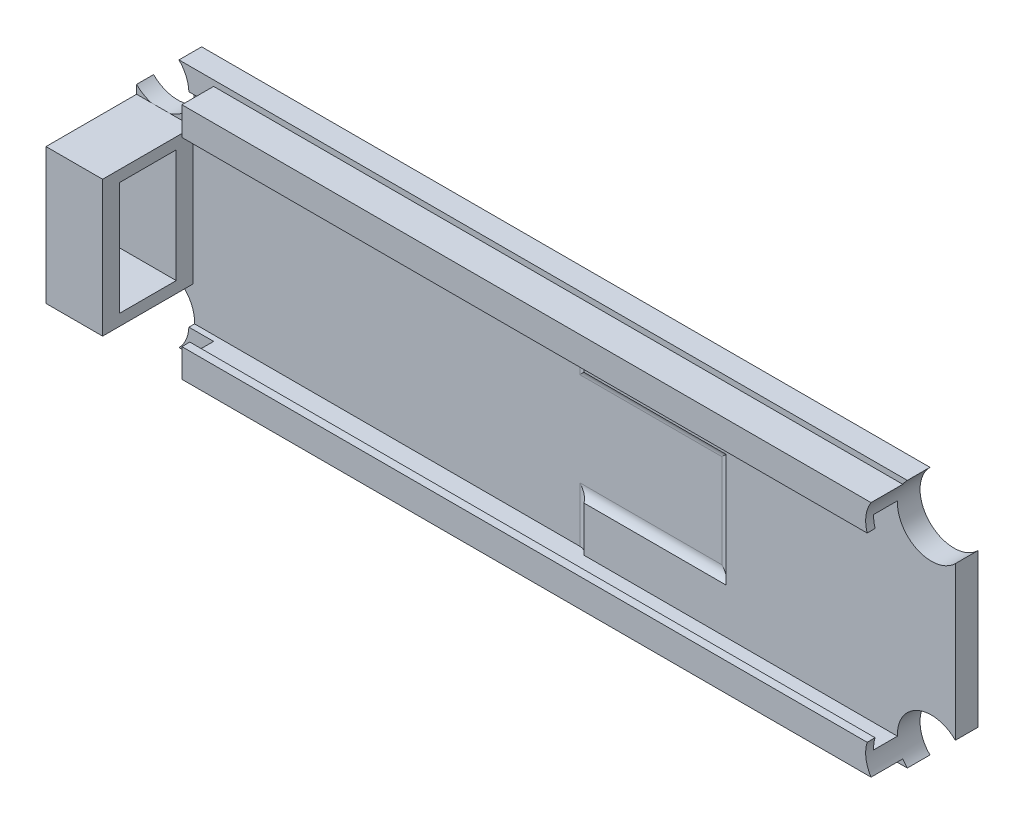
from build123d import *

# Parameters (mm, degrees)
SKIZZE1_W                       = 22
SKIZZE1_H                       = 72.8
AUFSATZ_LINEAR_AUSTRAGEN1_DEPTH = 2
SKIZZE2_R                       = 3
SCHNITT_LINEAR_AUSTRAGEN1_DEPTH = 2
SKIZZE3_W                       = 65.5
SKIZZE3_H                       = 21
AUFSATZ_LINEAR_AUSTRAGEN2_DEPTH = 2.8
SCHNITT_LINEAR_AUSTRAGEN2_DEPTH = 67.590464783
SKIZZE5_R                       = 3
SCHNITT_LINEAR_AUSTRAGEN4_DEPTH = 39.128729326
SKIZZE6_W                       = 18
SKIZZE6_H                       = 1
SCHNITT_LINEAR_AUSTRAGEN5_DEPTH = 40
SKIZZE8_W                       = 15
SKIZZE8_H                       = 10
SCHNITT_LINEAR_AUSTRAGEN6_DEPTH = 0.5
VERRUNDUNG3_R                   = 1
SKIZZE9_W                       = 5
SKIZZE9_H                       = 12
AUFSATZ_LINEAR_AUSTRAGEN3_DEPTH = 8
SKIZZE10_W                      = 10
SKIZZE10_H                      = 5
SCHNITT_LINEAR_AUSTRAGEN7_DEPTH = 75.236715983


with BuildPart() as part:
    # Skizze1 → Aufsatz-Linear austragen1 (new body)
    with BuildSketch(Plane(origin=(0, 0, 0), x_dir=(0, 1, 0), z_dir=(0, 0, 1))):
        Rectangle(SKIZZE1_W, SKIZZE1_H)
    extrude(amount=AUFSATZ_LINEAR_AUSTRAGEN1_DEPTH)

    # Skizze2 → Schnitt-Linear austragen1 (cut)
    with BuildSketch(Plane.XY.offset(2)):
        with Locations((-34.28, 8.88)):
            Circle(SKIZZE2_R)
        with Locations((-34.28, -8.88)):
            Circle(SKIZZE2_R)
        with Locations((34.28, -8.88)):
            Circle(SKIZZE2_R)
        with Locations((34.28, 8.88)):
            Circle(SKIZZE2_R)
    extrude(amount=-SCHNITT_LINEAR_AUSTRAGEN1_DEPTH, mode=Mode.SUBTRACT)

    # Skizze3 → Aufsatz-Linear austragen2 (add)
    with BuildSketch(Plane.XY.offset(2)):
        with Locations((3.65, 0)):
            Rectangle(SKIZZE3_W, SKIZZE3_H)
    extrude(amount=AUFSATZ_LINEAR_AUSTRAGEN2_DEPTH)

    # Skizze4 → Schnitt-Linear austragen2 (cut, through all)
    with BuildSketch(Plane(origin=(-29.1, 0, 0), x_dir=(0, -1, 0), z_dir=(-1, 0, 0))):
        Polygon((-8, 4.8), (8, 4.8), (8, 4.1), (9, 4.1), (9, 2), (-9, 2), (-9, 4.1), (-8, 4.1), align=None)
    extrude(amount=-SCHNITT_LINEAR_AUSTRAGEN2_DEPTH, mode=Mode.SUBTRACT)

    # Skizze5 → Schnitt-Linear austragen4 (cut, through all)
    with BuildSketch(Plane(origin=(0, 0, 2), x_dir=(1, 0, 0), z_dir=(0, 0, -1))):
        with Locations((34.28, -8.88)):
            Circle(SKIZZE5_R)
        with Locations((34.28, 8.88)):
            Circle(SKIZZE5_R)
    extrude(amount=-SCHNITT_LINEAR_AUSTRAGEN4_DEPTH, mode=Mode.SUBTRACT)

    # Skizze6 → Schnitt-Linear austragen5 (cut)
    with BuildSketch(Plane(origin=(-36.4, 0, 0), x_dir=(0, -1, 0), z_dir=(-1, 0, 0))):
        with Locations((0, 2)):
            Rectangle(SKIZZE6_W, SKIZZE6_H)
    extrude(amount=-SCHNITT_LINEAR_AUSTRAGEN5_DEPTH, mode=Mode.SUBTRACT)

    # Skizze8 → Schnitt-Linear austragen6 (cut)
    with BuildSketch(Plane.XY.offset(2)):
        with Locations((8.655984658, -0.007335612)):
            Rectangle(SKIZZE8_W, SKIZZE8_H)
    extrude(amount=-SCHNITT_LINEAR_AUSTRAGEN6_DEPTH, mode=Mode.SUBTRACT)

    # Verrundung3
    # the kernel refuses this fillet: 1 mm, written as the material it adds along each edge
    with BuildSketch(Plane(origin=(3.6, -9, 1.5), x_dir=(0, 0, 1), z_dir=(0, 1, 0))) as verrundung3_piece_1:
        with BuildLine():
            CenterArc((1, -0.866025404), VERRUNDUNG3_R, 120, 60)
            Line((0, -0.866025404), (-0.02, -0.866025404))
            Line((-0.02, -0.866025404), (-0.02, 0))
            Line((-0.02, 0), (0, 0.02))
            ThreePointArc((0, 0.02), (0.25, 0.02), (0.49, 0.017320508))
            Line((0.49, 0.017320508), (0.5, 0))
        make_face()
    extrude(amount=3.992664388)
    with BuildSketch(Plane(origin=(3.6, -5.007335612, 1.5), x_dir=(0, 0, 1), z_dir=(1, 0, 0)), Plane(origin=(16.155984658, 4.992664388, 1.5), x_dir=(0, 0, 1), z_dir=(-1, 0, 0))) as verrundung3_piece_2:
        with BuildLine():
            CenterArc((1, -0.866025404), VERRUNDUNG3_R, 120, 60)
            Line((0, -0.866025404), (-0.02, -0.866025404))
            Line((-0.02, -0.866025404), (-0.02, 0))
            Line((-0.02, 0), (0, 0.02))
            ThreePointArc((0, 0.02), (0.25, 0.02), (0.49, 0.017320508))
            Line((0.49, 0.017320508), (0.5, 0))
        make_face()
    extrude(amount=12.555984658)
    with BuildSketch(Plane(origin=(3.6, 4.992664388, 1.5), x_dir=(0, 0, 1), z_dir=(0, 1, 0))) as verrundung3_piece_3:
        with BuildLine():
            CenterArc((1, -0.866025404), VERRUNDUNG3_R, 120, 60)
            Line((0, -0.866025404), (-0.02, -0.866025404))
            Line((-0.02, -0.866025404), (-0.02, 0))
            Line((-0.02, 0), (0, 0.02))
            ThreePointArc((0, 0.02), (0.25, 0.02), (0.49, 0.017320508))
            Line((0.49, 0.017320508), (0.5, 0))
        make_face()
    extrude(amount=4.007335612)
    with BuildSketch(Plane(origin=(16.155984658, -5.007335612, 1.5), x_dir=(0, 0, 1), z_dir=(0, 1, 0))) as verrundung3_piece_4:
        with BuildLine():
            CenterArc((1, -0.866025404), VERRUNDUNG3_R, 120, 60)
            Line((0, -0.866025404), (-0.02, -0.866025404))
            Line((-0.02, -0.866025404), (-0.02, 0))
            Line((-0.02, 0), (0, 0.02))
            ThreePointArc((0, 0.02), (0.25, 0.02), (0.49, 0.017320508))
            Line((0.49, 0.017320508), (0.5, 0))
        make_face()
    extrude(amount=10)
    with BuildSketch(Plane(origin=(3.6, -9, 1.5), x_dir=(0, 0, 1), z_dir=(0, 1, 0))) as verrundung3_piece_5a_section:
        with BuildLine():
            CenterArc((1, -0.866025404), VERRUNDUNG3_R, 120, 60)
            Line((0, -0.866025404), (-0.02, -0.866025404))
            Line((-0.02, -0.866025404), (-0.02, 0))
            Line((-0.02, 0), (0, 0.02))
            ThreePointArc((0, 0.02), (0.25, 0.02), (0.49, 0.017320508))
            Line((0.49, 0.017320508), (0.5, 0))
        make_face()
    verrundung3_piece_5a = extrude(amount=6.157727897, mode=Mode.PRIVATE)
    verrundung3_piece_5a = split(verrundung3_piece_5a, bisect_by=Plane(origin=(3.383689554, -5.007335612, 1.629516711), z_dir=(0, 1, 0)), keep=Keep.TOP, mode=Mode.PRIVATE)
    with BuildSketch(Plane(origin=(1.434936491, -5.007335612, 1.5), x_dir=(0, 0, 1), z_dir=(1, 0, 0))) as verrundung3_piece_5b_section:
        with BuildLine():
            CenterArc((1, -0.866025404), VERRUNDUNG3_R, 120, 60)
            Line((0, -0.866025404), (-0.02, -0.866025404))
            Line((-0.02, -0.866025404), (-0.02, 0))
            Line((-0.02, 0), (0, 0.02))
            ThreePointArc((0, 0.02), (0.25, 0.02), (0.49, 0.017320508))
            Line((0.49, 0.017320508), (0.5, 0))
        make_face()
    verrundung3_piece_5b = extrude(amount=14.721048168, mode=Mode.PRIVATE)
    verrundung3_piece_5b = split(verrundung3_piece_5b, bisect_by=Plane(origin=(3.6, -4.791025166, 1.629516711), z_dir=(-1, 0, 0)), keep=Keep.TOP, mode=Mode.PRIVATE)
    verrundung3_piece_5 = verrundung3_piece_5a & verrundung3_piece_5b
    add(verrundung3_piece_5)
    with BuildSketch(Plane(origin=(3.6, -5.007335612, 1.5), x_dir=(0, 0, 1), z_dir=(1, 0, 0))) as verrundung3_piece_6a_section:
        with BuildLine():
            CenterArc((1, -0.866025404), VERRUNDUNG3_R, 120, 60)
            Line((0, -0.866025404), (-0.02, -0.866025404))
            Line((-0.02, -0.866025404), (-0.02, 0))
            Line((-0.02, 0), (0, 0.02))
            ThreePointArc((0, 0.02), (0.25, 0.02), (0.49, 0.017320508))
            Line((0.49, 0.017320508), (0.5, 0))
        make_face()
    verrundung3_piece_6a = extrude(amount=14.721048168, mode=Mode.PRIVATE)
    verrundung3_piece_6a = split(verrundung3_piece_6a, bisect_by=Plane(origin=(16.155984658, -4.791025166, 1.629516711), z_dir=(1, 0, 0)), keep=Keep.TOP, mode=Mode.PRIVATE)
    with BuildSketch(Plane(origin=(16.155984658, -7.172399122, 1.5), x_dir=(0, 0, 1), z_dir=(0, 1, 0))) as verrundung3_piece_6b_section:
        with BuildLine():
            CenterArc((1, -0.866025404), VERRUNDUNG3_R, 120, 60)
            Line((0, -0.866025404), (-0.02, -0.866025404))
            Line((-0.02, -0.866025404), (-0.02, 0))
            Line((-0.02, 0), (0, 0.02))
            ThreePointArc((0, 0.02), (0.25, 0.02), (0.49, 0.017320508))
            Line((0.49, 0.017320508), (0.5, 0))
        make_face()
    verrundung3_piece_6b = extrude(amount=12.165063509, mode=Mode.PRIVATE)
    verrundung3_piece_6b = split(verrundung3_piece_6b, bisect_by=Plane(origin=(15.939674213, -5.007335612, 1.629516711), z_dir=(0, -1, 0)), keep=Keep.TOP, mode=Mode.PRIVATE)
    verrundung3_piece_6 = verrundung3_piece_6a & verrundung3_piece_6b
    add(verrundung3_piece_6)
    with BuildSketch(Plane(origin=(16.155984658, 4.992664388, 1.5), x_dir=(0, 0, 1), z_dir=(-1, 0, 0))) as verrundung3_piece_7a_section:
        with BuildLine():
            CenterArc((1, -0.866025404), VERRUNDUNG3_R, 120, 60)
            Line((0, -0.866025404), (-0.02, -0.866025404))
            Line((-0.02, -0.866025404), (-0.02, 0))
            Line((-0.02, 0), (0, 0.02))
            ThreePointArc((0, 0.02), (0.25, 0.02), (0.49, 0.017320508))
            Line((0.49, 0.017320508), (0.5, 0))
        make_face()
    verrundung3_piece_7a = extrude(amount=14.721048168, mode=Mode.PRIVATE)
    verrundung3_piece_7a = split(verrundung3_piece_7a, bisect_by=Plane(origin=(3.6, 4.776353942, 1.629516711), z_dir=(-1, 0, 0)), keep=Keep.TOP, mode=Mode.PRIVATE)
    with BuildSketch(Plane(origin=(3.6, 2.827600878, 1.5), x_dir=(0, 0, 1), z_dir=(0, 1, 0))) as verrundung3_piece_7b_section:
        with BuildLine():
            CenterArc((1, -0.866025404), VERRUNDUNG3_R, 120, 60)
            Line((0, -0.866025404), (-0.02, -0.866025404))
            Line((-0.02, -0.866025404), (-0.02, 0))
            Line((-0.02, 0), (0, 0.02))
            ThreePointArc((0, 0.02), (0.25, 0.02), (0.49, 0.017320508))
            Line((0.49, 0.017320508), (0.5, 0))
        make_face()
    verrundung3_piece_7b = extrude(amount=6.172399122, mode=Mode.PRIVATE)
    verrundung3_piece_7b = split(verrundung3_piece_7b, bisect_by=Plane(origin=(3.383689554, 4.992664388, 1.629516711), z_dir=(0, -1, 0)), keep=Keep.TOP, mode=Mode.PRIVATE)
    verrundung3_piece_7 = verrundung3_piece_7a & verrundung3_piece_7b
    add(verrundung3_piece_7)
    with BuildSketch(Plane(origin=(16.155984658, -5.007335612, 1.5), x_dir=(0, 0, 1), z_dir=(0, 1, 0))) as verrundung3_piece_8a_section:
        with BuildLine():
            CenterArc((1, -0.866025404), VERRUNDUNG3_R, 120, 60)
            Line((0, -0.866025404), (-0.02, -0.866025404))
            Line((-0.02, -0.866025404), (-0.02, 0))
            Line((-0.02, 0), (0, 0.02))
            ThreePointArc((0, 0.02), (0.25, 0.02), (0.49, 0.017320508))
            Line((0.49, 0.017320508), (0.5, 0))
        make_face()
    verrundung3_piece_8a = extrude(amount=12.165063509, mode=Mode.PRIVATE)
    verrundung3_piece_8a = split(verrundung3_piece_8a, bisect_by=Plane(origin=(15.939674213, 4.992664388, 1.629516711), z_dir=(0, 1, 0)), keep=Keep.TOP, mode=Mode.PRIVATE)
    with BuildSketch(Plane(origin=(18.321048168, 4.992664388, 1.5), x_dir=(0, 0, 1), z_dir=(-1, 0, 0))) as verrundung3_piece_8b_section:
        with BuildLine():
            CenterArc((1, -0.866025404), VERRUNDUNG3_R, 120, 60)
            Line((0, -0.866025404), (-0.02, -0.866025404))
            Line((-0.02, -0.866025404), (-0.02, 0))
            Line((-0.02, 0), (0, 0.02))
            ThreePointArc((0, 0.02), (0.25, 0.02), (0.49, 0.017320508))
            Line((0.49, 0.017320508), (0.5, 0))
        make_face()
    verrundung3_piece_8b = extrude(amount=14.721048168, mode=Mode.PRIVATE)
    verrundung3_piece_8b = split(verrundung3_piece_8b, bisect_by=Plane(origin=(16.155984658, 4.776353942, 1.629516711), z_dir=(1, 0, 0)), keep=Keep.TOP, mode=Mode.PRIVATE)
    verrundung3_piece_8 = verrundung3_piece_8a & verrundung3_piece_8b
    add(verrundung3_piece_8)

    # Skizze9 → Aufsatz-Linear austragen3 (add)
    with BuildSketch(Plane.XY.offset(1.5)):
        with Locations((-33.9, 0)):
            Rectangle(SKIZZE9_W, SKIZZE9_H)
    extrude(amount=AUFSATZ_LINEAR_AUSTRAGEN3_DEPTH)

    # Skizze10 → Schnitt-Linear austragen7 (cut, through all)
    with BuildSketch(Plane(origin=(-36.4, 0, 0), x_dir=(0, -1, 0), z_dir=(-1, 0, 0))):
        with Locations((0, 5.5)):
            Rectangle(SKIZZE10_W, SKIZZE10_H)
    extrude(amount=-SCHNITT_LINEAR_AUSTRAGEN7_DEPTH, mode=Mode.SUBTRACT)


solid = part.part
